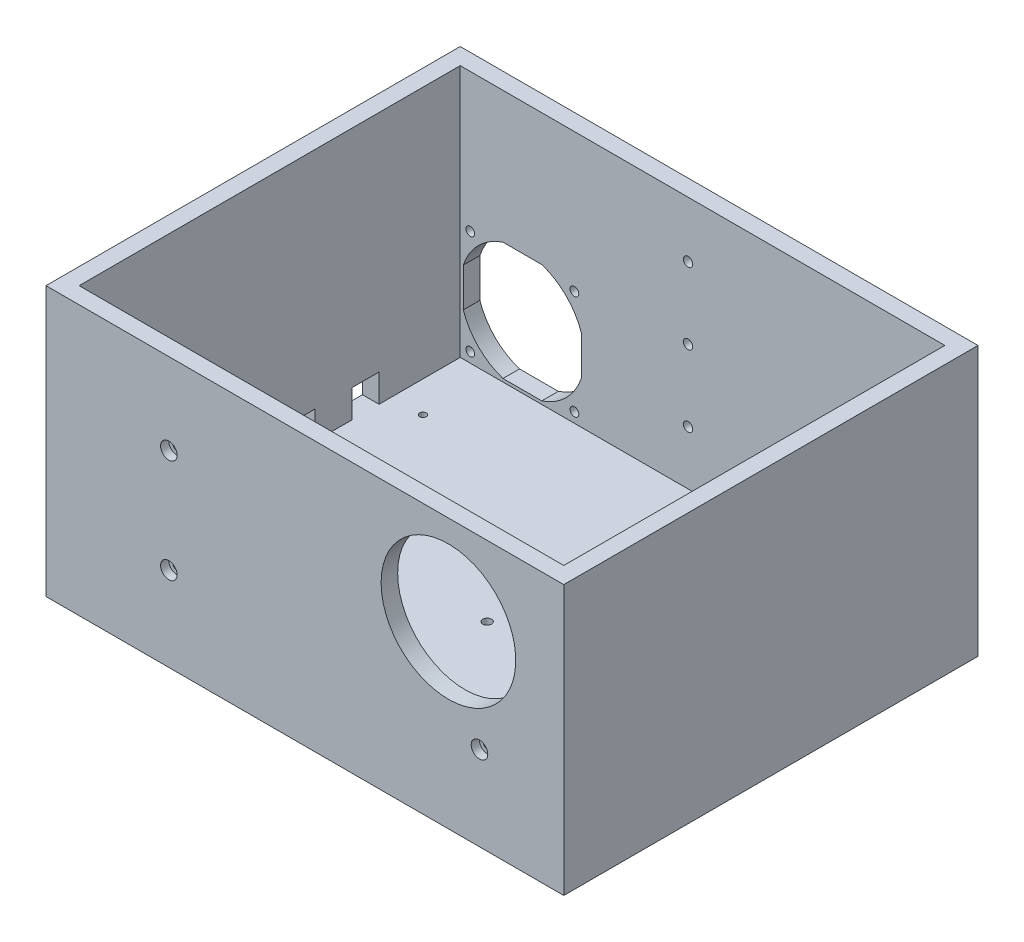
from build123d import *

# Parameters (mm, degrees)
SKETCH_1_W          = 250
SKETCH_1_H          = 200
EXTRUDE_1_DEPTH     = 130
SHELL_1_T           = -8
CUT_EXTRUDE_1_REACH = 265.418
SKETCH_2_R          = 2.15
SKETCH_2_R_2        = 32.5
SKETCH_4_R          = 4
CUT_EXTRUDE_3_DEPTH = 4
SKETCH_3_R          = 2.1
CUT_EXTRUDE_2_DEPTH = 202.268477413
CUT_EXTRUDE_4_REACH = 271.305
SKETCH_5_R          = 2.25
SKETCH_6_R          = 1.6
CUT_EXTRUDE_5_DEPTH = 202.268477413
CUT_EXTRUDE_6_REACH = 300.998
SKETCH_7_W          = 13
SKETCH_7_H          = 13.5
SKETCH_7_W_2        = 10.5
CUT_EXTRUDE_7_REACH = 271.305
SKETCH_8_R          = 2.1


with BuildPart() as part:
    # 草圖1 → 填料-伸長1 (new body)
    with BuildSketch(Plane(origin=(0, 0, 0), x_dir=(1, 0, 0), z_dir=(0, 1, 0))):
        Rectangle(SKETCH_1_W, SKETCH_1_H)
    extrude(amount=EXTRUDE_1_DEPTH)

    # 薄殼1
    shell_1_openings = [part.faces().sort_by_distance(p)[0] for p in [
        (0, 130, 0),
    ]]
    offset(amount=SHELL_1_T, openings=shell_1_openings, kind=Kind.INTERSECTION)

    # 草圖2 → 除料-伸長1 (cut, up to next)
    with BuildSketch(Plane(origin=(0, 0, 92), x_dir=(-1, 0, 0), z_dir=(0, 0, -1)), mode=Mode.PRIVATE) as cut_extrude_1_sk1:
        with Locations((65.7, 90.7)):
            Circle(SKETCH_2_R)
    cut_extrude_1_tool1 = extrude(cut_extrude_1_sk1.sketch, amount=-CUT_EXTRUDE_1_REACH, mode=Mode.PRIVATE) & part.part
    # 草圖2 → 除料-伸長1 (cut, up to next)
    with BuildSketch(Plane(origin=(0, 0, 92), x_dir=(-1, 0, 0), z_dir=(0, 0, -1)), mode=Mode.PRIVATE) as cut_extrude_1_sk2:
        with Locations((65.7, 40.7)):
            Circle(SKETCH_2_R)
    cut_extrude_1_tool2 = extrude(cut_extrude_1_sk2.sketch, amount=-CUT_EXTRUDE_1_REACH, mode=Mode.PRIVATE) & part.part
    # 草圖2 → 除料-伸長1 (cut, up to next)
    with BuildSketch(Plane(origin=(0, 0, 92), x_dir=(-1, 0, 0), z_dir=(0, 0, -1)), mode=Mode.PRIVATE) as cut_extrude_1_sk3:
        with Locations((-84.3, 40.7)):
            Circle(SKETCH_2_R)
    cut_extrude_1_tool3 = extrude(cut_extrude_1_sk3.sketch, amount=-CUT_EXTRUDE_1_REACH, mode=Mode.PRIVATE) & part.part
    # 草圖2 → 除料-伸長1 (cut, up to next)
    with BuildSketch(Plane(origin=(0, 0, 92), x_dir=(-1, 0, 0), z_dir=(0, 0, -1)), mode=Mode.PRIVATE) as cut_extrude_1_sk4:
        with Locations((-69.3, 86.7)):
            Circle(SKETCH_2_R_2)
    cut_extrude_1_tool4 = extrude(cut_extrude_1_sk4.sketch, amount=-CUT_EXTRUDE_1_REACH, mode=Mode.PRIVATE) & part.part
    add(cut_extrude_1_tool1.solids().sort_by_distance((-65.7, 90.7, 92))[0], mode=Mode.SUBTRACT)
    add(cut_extrude_1_tool2.solids().sort_by_distance((-65.7, 40.7, 92))[0], mode=Mode.SUBTRACT)
    add(cut_extrude_1_tool3.solids().sort_by_distance((84.3, 40.7, 92))[0], mode=Mode.SUBTRACT)
    add(cut_extrude_1_tool4.solids().sort_by_distance((69.3, 86.7, 92))[0], mode=Mode.SUBTRACT)

    # 草圖4 → 除料-伸長3 (cut)
    with BuildSketch(Plane.XY.offset(100)):
        with Locations((84.3, 40.7)):
            Circle(SKETCH_4_R)
        with Locations((-65.7, 90.7)):
            Circle(SKETCH_4_R)
        with Locations((-65.7, 40.7)):
            Circle(SKETCH_4_R)
    extrude(amount=-CUT_EXTRUDE_3_DEPTH, mode=Mode.SUBTRACT)

    # 草圖3 → 除料-伸長2 (cut, through all)
    with BuildSketch(Plane(origin=(0, 8, 0), x_dir=(1, 0, 0), z_dir=(0, 1, 0))):
        with Locations((0, 10.5)):
            Circle(SKETCH_3_R)
        with Locations((0, -12)):
            Circle(SKETCH_3_R)
        with Locations((112, 10.5)):
            Circle(SKETCH_3_R)
        with Locations((112, -12)):
            Circle(SKETCH_3_R)
    extrude(amount=-CUT_EXTRUDE_2_DEPTH, mode=Mode.SUBTRACT)

    # 草圖5 → 除料-伸長4 (cut, up to next)
    with BuildSketch(Plane(origin=(0, 0, -100), x_dir=(-1, 0, 0), z_dir=(0, 0, -1)), mode=Mode.PRIVATE) as cut_extrude_4_sk1:
        with Locations((-105, 34)):
            Circle(SKETCH_5_R)
    cut_extrude_4_tool1 = extrude(cut_extrude_4_sk1.sketch, amount=-CUT_EXTRUDE_4_REACH, mode=Mode.PRIVATE) & part.part
    # 草圖5 → 除料-伸長4 (cut, up to next)
    with BuildSketch(Plane(origin=(0, 0, -100), x_dir=(-1, 0, 0), z_dir=(0, 0, -1)), mode=Mode.PRIVATE) as cut_extrude_4_sk2:
        with Locations((7, 34)):
            Circle(SKETCH_5_R)
    cut_extrude_4_tool2 = extrude(cut_extrude_4_sk2.sketch, amount=-CUT_EXTRUDE_4_REACH, mode=Mode.PRIVATE) & part.part
    # 草圖5 → 除料-伸長4 (cut, up to next)
    with BuildSketch(Plane(origin=(0, 0, -100), x_dir=(-1, 0, 0), z_dir=(0, 0, -1)), mode=Mode.PRIVATE) as cut_extrude_4_sk3:
        with Locations((-105, 68.5)):
            Circle(SKETCH_5_R)
    cut_extrude_4_tool3 = extrude(cut_extrude_4_sk3.sketch, amount=-CUT_EXTRUDE_4_REACH, mode=Mode.PRIVATE) & part.part
    # 草圖5 → 除料-伸長4 (cut, up to next)
    with BuildSketch(Plane(origin=(0, 0, -100), x_dir=(-1, 0, 0), z_dir=(0, 0, -1)), mode=Mode.PRIVATE) as cut_extrude_4_sk4:
        with Locations((7, 68.5)):
            Circle(SKETCH_5_R)
    cut_extrude_4_tool4 = extrude(cut_extrude_4_sk4.sketch, amount=-CUT_EXTRUDE_4_REACH, mode=Mode.PRIVATE) & part.part
    # 草圖5 → 除料-伸長4 (cut, up to next)
    with BuildSketch(Plane(origin=(0, 0, -100), x_dir=(-1, 0, 0), z_dir=(0, 0, -1)), mode=Mode.PRIVATE) as cut_extrude_4_sk5:
        with Locations((-105, 103)):
            Circle(SKETCH_5_R)
    cut_extrude_4_tool5 = extrude(cut_extrude_4_sk5.sketch, amount=-CUT_EXTRUDE_4_REACH, mode=Mode.PRIVATE) & part.part
    # 草圖5 → 除料-伸長4 (cut, up to next)
    with BuildSketch(Plane(origin=(0, 0, -100), x_dir=(-1, 0, 0), z_dir=(0, 0, -1)), mode=Mode.PRIVATE) as cut_extrude_4_sk6:
        with Locations((7, 103)):
            Circle(SKETCH_5_R)
    cut_extrude_4_tool6 = extrude(cut_extrude_4_sk6.sketch, amount=-CUT_EXTRUDE_4_REACH, mode=Mode.PRIVATE) & part.part
    add(cut_extrude_4_tool1.solids().sort_by_distance((105, 34, -100))[0], mode=Mode.SUBTRACT)
    add(cut_extrude_4_tool2.solids().sort_by_distance((-7, 34, -100))[0], mode=Mode.SUBTRACT)
    add(cut_extrude_4_tool3.solids().sort_by_distance((105, 68.5, -100))[0], mode=Mode.SUBTRACT)
    add(cut_extrude_4_tool4.solids().sort_by_distance((-7, 68.5, -100))[0], mode=Mode.SUBTRACT)
    add(cut_extrude_4_tool5.solids().sort_by_distance((105, 103, -100))[0], mode=Mode.SUBTRACT)
    add(cut_extrude_4_tool6.solids().sort_by_distance((-7, 103, -100))[0], mode=Mode.SUBTRACT)

    # 草圖6 → 除料-伸長5 (cut, through all)
    with BuildSketch(Plane(origin=(0, 8, 0), x_dir=(1, 0, 0), z_dir=(0, 1, 0))):
        with Locations((-102, 59)):
            Circle(SKETCH_6_R)
        with Locations((-19.374, 10.6638)):
            Circle(SKETCH_6_R)
    extrude(amount=-CUT_EXTRUDE_5_DEPTH, mode=Mode.SUBTRACT)

    # 草圖7 → 除料-伸長6 (cut, up to next)
    with BuildSketch(Plane.ZY.offset(125), mode=Mode.PRIVATE) as cut_extrude_6_sk1:
        with Locations((-46.3, 14.75)):
            Rectangle(SKETCH_7_W, SKETCH_7_H)
    cut_extrude_6_tool1 = extrude(cut_extrude_6_sk1.sketch, amount=-CUT_EXTRUDE_6_REACH, mode=Mode.PRIVATE) & part.part
    # 草圖7 → 除料-伸長6 (cut, up to next)
    with BuildSketch(Plane.ZY.offset(125), mode=Mode.PRIVATE) as cut_extrude_6_sk2:
        with Locations((-16.55, 14.75)):
            Rectangle(SKETCH_7_W_2, SKETCH_7_H)
    cut_extrude_6_tool2 = extrude(cut_extrude_6_sk2.sketch, amount=-CUT_EXTRUDE_6_REACH, mode=Mode.PRIVATE) & part.part
    add(cut_extrude_6_tool1.solids().sort_by_distance((-125, 14.75, -46.3))[0], mode=Mode.SUBTRACT)
    add(cut_extrude_6_tool2.solids().sort_by_distance((-125, 14.75, -16.55))[0], mode=Mode.SUBTRACT)

    # 草圖8 → 除料-伸長7 (cut, up to next)
    with BuildSketch(Plane(origin=(0, 0, -100), x_dir=(-1, 0, 0), z_dir=(0, 0, -1)), mode=Mode.PRIVATE) as cut_extrude_7_sk1:
        with BuildLine():
            Line((58.5, 47.367496998), (58.5, 28.632503002))
            ThreePointArc((58.5, 28.632503002), (65.786796564, 16.786796564), (77.632503002, 9.5))
            Line((77.632503002, 9.5), (96.367496998, 9.5))
            ThreePointArc((96.367496998, 9.5), (108.213203436, 16.786796564), (115.5, 28.632503002))
            Line((115.5, 28.632503002), (115.5, 47.367496998))
            ThreePointArc((115.5, 47.367496998), (108.213203436, 59.213203436), (96.367496998, 66.5))
            Line((96.367496998, 66.5), (77.632503002, 66.5))
            ThreePointArc((77.632503002, 66.5), (65.786796564, 59.213203436), (58.5, 47.367496998))
        make_face()
    cut_extrude_7_tool1 = extrude(cut_extrude_7_sk1.sketch, amount=-CUT_EXTRUDE_7_REACH, mode=Mode.PRIVATE) & part.part
    # 草圖8 → 除料-伸長7 (cut, up to next)
    with BuildSketch(Plane(origin=(0, 0, -100), x_dir=(-1, 0, 0), z_dir=(0, 0, -1)), mode=Mode.PRIVATE) as cut_extrude_7_sk2:
        with Locations((61.85, 63.15)):
            Circle(SKETCH_8_R)
    cut_extrude_7_tool2 = extrude(cut_extrude_7_sk2.sketch, amount=-CUT_EXTRUDE_7_REACH, mode=Mode.PRIVATE) & part.part
    # 草圖8 → 除料-伸長7 (cut, up to next)
    with BuildSketch(Plane(origin=(0, 0, -100), x_dir=(-1, 0, 0), z_dir=(0, 0, -1)), mode=Mode.PRIVATE) as cut_extrude_7_sk3:
        with Locations((61.85, 12.85)):
            Circle(SKETCH_8_R)
    cut_extrude_7_tool3 = extrude(cut_extrude_7_sk3.sketch, amount=-CUT_EXTRUDE_7_REACH, mode=Mode.PRIVATE) & part.part
    # 草圖8 → 除料-伸長7 (cut, up to next)
    with BuildSketch(Plane(origin=(0, 0, -100), x_dir=(-1, 0, 0), z_dir=(0, 0, -1)), mode=Mode.PRIVATE) as cut_extrude_7_sk4:
        with Locations((112.15, 63.15)):
            Circle(SKETCH_8_R)
    cut_extrude_7_tool4 = extrude(cut_extrude_7_sk4.sketch, amount=-CUT_EXTRUDE_7_REACH, mode=Mode.PRIVATE) & part.part
    # 草圖8 → 除料-伸長7 (cut, up to next)
    with BuildSketch(Plane(origin=(0, 0, -100), x_dir=(-1, 0, 0), z_dir=(0, 0, -1)), mode=Mode.PRIVATE) as cut_extrude_7_sk5:
        with Locations((112.15, 12.85)):
            Circle(SKETCH_8_R)
    cut_extrude_7_tool5 = extrude(cut_extrude_7_sk5.sketch, amount=-CUT_EXTRUDE_7_REACH, mode=Mode.PRIVATE) & part.part
    add(cut_extrude_7_tool1.solids().sort_by_distance((-87, 38, -100))[0], mode=Mode.SUBTRACT)
    add(cut_extrude_7_tool2.solids().sort_by_distance((-61.85, 63.15, -100))[0], mode=Mode.SUBTRACT)
    add(cut_extrude_7_tool3.solids().sort_by_distance((-61.85, 12.85, -100))[0], mode=Mode.SUBTRACT)
    add(cut_extrude_7_tool4.solids().sort_by_distance((-112.15, 63.15, -100))[0], mode=Mode.SUBTRACT)
    add(cut_extrude_7_tool5.solids().sort_by_distance((-112.15, 12.85, -100))[0], mode=Mode.SUBTRACT)


solid = part.part
